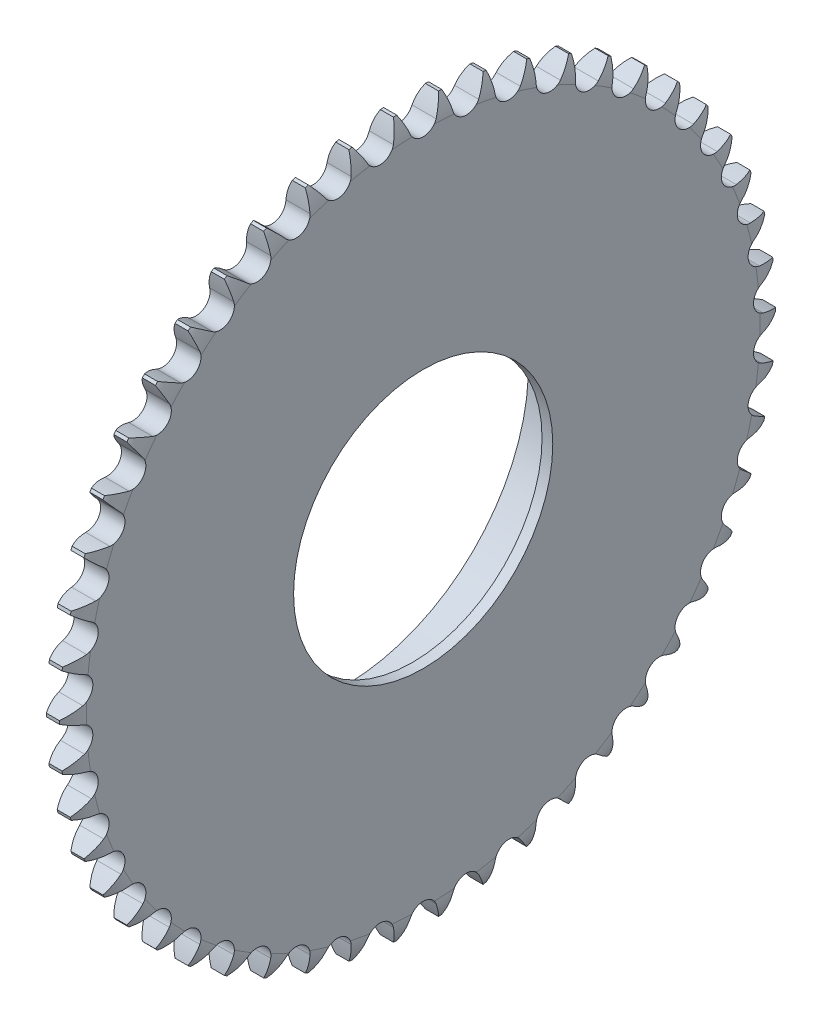
from build123d import *

# Parameters (mm, degrees)
TOOTHCUT_DEPTH           = 186.836250828
TEETHCUTS_COUNT          = 50
TEETHCUTS_ANGLE          = 352.8
HUBNEAONESKE_R           = 75
HUBNEARONE_DEPTH         = 20
HUBNEARONEFILLET_R       = 0.6
BORSKE_R                 = 47.5
BORE_DEPTH               = 25.0005
SCHIZZO1_R               = 67.5
TAGLIO_ESTRUSIONE1_DEPTH = 25


with BuildPart() as part:
    # BasProSke → Base-Revolve (revolve)
    with BuildSketch(Plane(origin=(0, 0, 0), x_dir=(1, 0, 0), z_dir=(0, 1, 0))):
        with BuildLine():
            Line((0, 0), (0, 123.427074752))
            ThreePointArc((0, 123.427074752), (0.524605563, 127.47442149), (2.06375, 131.254270829))
            Line((2.06375, 131.254270829), (6.86625, 131.254270829))
            ThreePointArc((6.86625, 131.254270829), (8.405394437, 127.47442149), (8.93, 123.427074752))
            Line((8.93, 123.427074752), (8.93, 0))
            Line((8.93, 0), (0, 0))
        make_face()
    revolve(axis=Axis((-10, 0, 0), (1, 0, 0)))

    # TooCutSke → ToothCut (cut, through all)
    with BuildSketch(Plane(origin=(0, 0, 0), x_dir=(0, 0, -1), z_dir=(1, 0, 0))):
        with BuildLine():
            ThreePointArc((4.793216317, 124.632844502), (6.245871471, 128.121287584), (7.903779946, 131.516988044))
            ThreePointArc((7.903779946, 131.516988044), (0, 131.754270829), (-7.903779946, 131.516988044))
            ThreePointArc((-7.903779946, 131.516988044), (-6.245871471, 128.121287584), (-4.793216317, 124.632844502))
            ThreePointArc((-4.793216317, 124.632844502), (0, 121.332395829), (4.793216317, 124.632844502))
        make_face()
    toothcut = extrude(amount=TOOTHCUT_DEPTH, mode=Mode.SUBTRACT)

    # TeethCuts: ToothCut ×50 about axis
    teethcuts_axis = Axis((-10, 0, 0), (1, 0, 0))
    for i in range(1, TEETHCUTS_COUNT):
        add(toothcut.rotate(teethcuts_axis, i * TEETHCUTS_ANGLE / (TEETHCUTS_COUNT - 1)), mode=Mode.SUBTRACT)

    # HubNeaOneSke → HubNearOne (add)
    with BuildSketch(Plane.ZY):
        Circle(HUBNEAONESKE_R)
    extrude(amount=HUBNEARONE_DEPTH)

    # HubNearOneFillet
    hubnearonefillet_edges = [part.edges().sort_by_distance(p)[0] for p in [
        (0, 0, -75),
    ]]
    fillet(hubnearonefillet_edges, radius=HUBNEARONEFILLET_R)

    # BorSke → Bore (cut, symmetric)
    with BuildSketch(Plane(origin=(0, 0, 0), x_dir=(0, 0, -1), z_dir=(1, 0, 0))):
        Circle(BORSKE_R)
    extrude(amount=BORE_DEPTH, both=True, mode=Mode.SUBTRACT)

    # Schizzo1 → Taglio-Estrusione1 (cut)
    with BuildSketch(Plane.ZY.offset(20)):
        Circle(SCHIZZO1_R)
    extrude(amount=-TAGLIO_ESTRUSIONE1_DEPTH, mode=Mode.SUBTRACT)


solid = part.part
